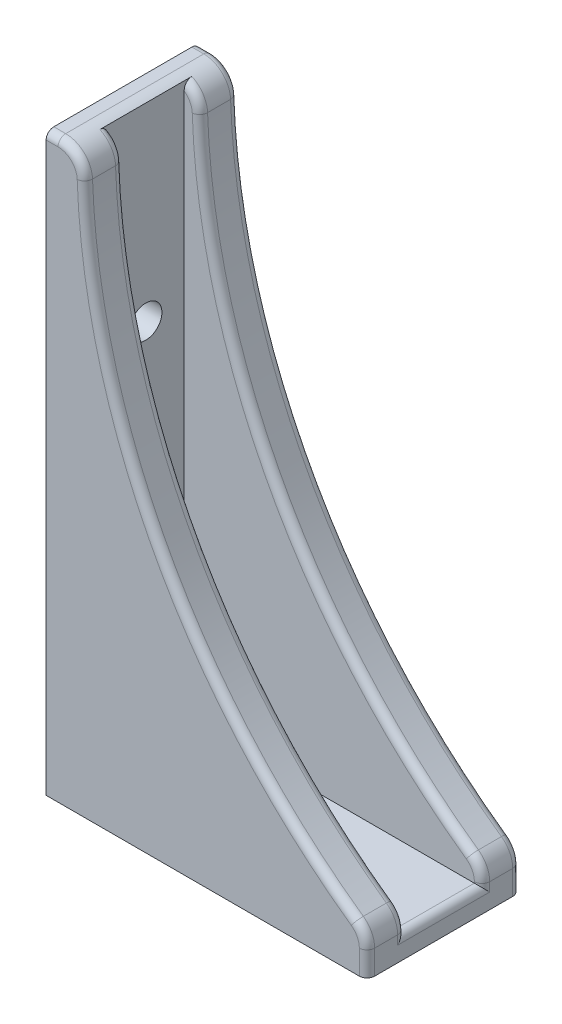
from build123d import *

# Parameters (mm, degrees)
BOSS_EXTRUDE1_DEPTH = 20
CUT_EXTRUDE1_DEPTH  = 15
BOSS_EXTRUDE2_DEPTH = 5
CUT_EXTRUDE2_REACH  = 90.178
SKETCH2_R           = 2.1
CUT_EXTRUDE3_REACH  = 90.178
SKETCH3_R           = 2.1
FILLET2_R           = 84
FILLET3_R           = 3.5
FILLET4_R           = 1


with BuildPart() as part:
    # Sketch1 → Boss-Extrude1 (new body)
    with BuildSketch(Plane.XY):
        Polygon((41.8365, 5), (5, 5), (5, 75), (0, 75), (0, 0), (41.8365, 0), align=None)
    extrude(amount=BOSS_EXTRUDE1_DEPTH)

    # Sketch1<3> → Cut-Extrude1 (cut)
    with BuildSketch(Plane.XY):
        Polygon((41.8365, 5), (5, 5), (5, 75), (3, 75), (3, 3), (41.8365, 3), align=None)
    extrude(amount=CUT_EXTRUDE1_DEPTH, mode=Mode.SUBTRACT)

    # Sketch1<4> → Boss-Extrude2 (add)
    with BuildSketch(Plane.XY):
        Polygon((41.8365, 5), (5, 5), (5, 75), (3, 75), (3, 3), (41.8365, 3), align=None)
    extrude(amount=BOSS_EXTRUDE2_DEPTH)

    # Sketch2 → Cut-Extrude2 (cut, up to next)
    with BuildSketch(Plane.XZ, mode=Mode.PRIVATE) as cut_extrude2_sk1:
        with Locations(Location((11.8365, 10, 0), (0, 0, 270))):
            Circle(SKETCH2_R)
    cut_extrude2_tool1 = extrude(cut_extrude2_sk1.sketch, amount=-CUT_EXTRUDE2_REACH, mode=Mode.PRIVATE) & part.part
    add(cut_extrude2_tool1.solids().sort_by_distance((11.8365, 0, 10))[0], mode=Mode.SUBTRACT)

    # Sketch3 → Cut-Extrude3 (cut, up to next)
    with BuildSketch(Plane.ZY, mode=Mode.PRIVATE) as cut_extrude3_sk1:
        with Locations((10, 25)):
            Circle(SKETCH3_R)
    cut_extrude3_tool1 = extrude(cut_extrude3_sk1.sketch, amount=-CUT_EXTRUDE3_REACH, mode=Mode.PRIVATE) & part.part
    # Sketch3 → Cut-Extrude3 (cut, up to next)
    with BuildSketch(Plane.ZY, mode=Mode.PRIVATE) as cut_extrude3_sk2:
        with Locations((10, 50)):
            Circle(SKETCH3_R)
    cut_extrude3_tool2 = extrude(cut_extrude3_sk2.sketch, amount=-CUT_EXTRUDE3_REACH, mode=Mode.PRIVATE) & part.part
    add(cut_extrude3_tool1.solids().sort_by_distance((0, 25, 10))[0], mode=Mode.SUBTRACT)
    add(cut_extrude3_tool2.solids().sort_by_distance((0, 50, 10))[0], mode=Mode.SUBTRACT)

    # Fillet2
    # the kernel refuses this fillet: 84 mm, written as the material it adds along each edge
    with BuildSketch(Plane(origin=(5, 5, -158.774355627), x_dir=(1, 0, 0), z_dir=(0, 0, 1))) as fillet2_piece_1_section:
        with BuildLine():
            CenterArc((84, 69.509742251), FILLET2_R, 180, 55.842464398)
            Line((0, 69.509742251), (-1.68, 69.509742251))
            Line((-1.68, 69.509742251), (-1.68, 0))
            Line((-1.68, 0), (0, -1.68))
            ThreePointArc((0, -1.68), (18.41825, -1.68), (35.89323, -1.390194845))
            Line((35.89323, -1.390194845), (36.8365, 0))
        make_face()
    fillet2_piece_1 = extrude(amount=178.774355627, mode=Mode.PRIVATE)
    fillet2_piece_1 = split(fillet2_piece_1, bisect_by=Plane(origin=(14.491057498, 22.671022952, 0), z_dir=(0, 0, 1)), keep=Keep.TOP, mode=Mode.PRIVATE)
    fillet2_piece_1 = split(fillet2_piece_1, bisect_by=Plane(origin=(14.491057498, 22.671022952, 5), z_dir=(0, 0, -1)), keep=Keep.TOP, mode=Mode.PRIVATE)
    add(fillet2_piece_1)
    with BuildSketch(Plane(origin=(5, 5, 15), x_dir=(1, 0, 0), z_dir=(0, 0, 1)), Plane(origin=(5, 5, 0), x_dir=(1, 0, 0), z_dir=(0, 0, 1))) as fillet2_piece_2:
        with BuildLine():
            CenterArc((84, 69.509742251), FILLET2_R, 180, 55.842464398)
            Line((0, 69.509742251), (-1.68, 69.509742251))
            Line((-1.68, 69.509742251), (-1.68, 0))
            Line((-1.68, 0), (0, -1.68))
            ThreePointArc((0, -1.68), (18.41825, -1.68), (35.89323, -1.390194845))
            Line((35.89323, -1.390194845), (36.8365, 0))
        make_face()
    extrude(amount=5)
    with BuildSketch(Plane(origin=(5, 5, 0), x_dir=(1, 0, 0), z_dir=(0, 0, 1))) as fillet2_piece_3_section:
        with BuildLine():
            CenterArc((84, 69.509742251), FILLET2_R, 180, 55.842464398)
            Line((0, 69.509742251), (-1.68, 69.509742251))
            Line((-1.68, 69.509742251), (-1.68, 0))
            Line((-1.68, 0), (0, -1.68))
            ThreePointArc((0, -1.68), (18.41825, -1.68), (35.89323, -1.390194845))
            Line((35.89323, -1.390194845), (36.8365, 0))
        make_face()
    fillet2_piece_3 = extrude(amount=178.774355627, mode=Mode.PRIVATE)
    fillet2_piece_3 = split(fillet2_piece_3, bisect_by=Plane(origin=(14.491057498, 22.671022952, 15), z_dir=(0, 0, 1)), keep=Keep.TOP, mode=Mode.PRIVATE)
    fillet2_piece_3 = split(fillet2_piece_3, bisect_by=Plane(origin=(14.491057498, 22.671022952, 20), z_dir=(0, 0, -1)), keep=Keep.TOP, mode=Mode.PRIVATE)
    add(fillet2_piece_3)

    # Fillet3
    # the kernel refuses this fillet: 3.5 mm, written as the material it adds along each edge
    with BuildSketch(Plane(origin=(3, 3, 5), x_dir=(1, 0, 0), z_dir=(0, 0, 1))) as fillet3_piece_1:
        with BuildLine():
            CenterArc((FILLET3_R, FILLET3_R), FILLET3_R, 180, 90)
            Line((0, FILLET3_R), (-FILLET3_R * 0.02, FILLET3_R))
            Line((-FILLET3_R * 0.02, FILLET3_R), (-FILLET3_R * 0.02, -FILLET3_R * 0.02))
            Line((-FILLET3_R * 0.02, -FILLET3_R * 0.02), (FILLET3_R, -FILLET3_R * 0.02))
            Line((FILLET3_R, -FILLET3_R * 0.02), (FILLET3_R, 0))
        make_face()
    extrude(amount=10)
    # the kernel refuses this fillet: 3.5 mm, written as the material it takes off along each edge
    with BuildSketch(Plane(origin=(5, 75, -20.689329277), x_dir=(-1, 0, 0), z_dir=(0, 0, 1))) as fillet3_2_piece_1:
        with BuildLine():
            CenterArc((3.448221546, 3.5), FILLET3_R, 181.971194875, 88.028805125)
            Line((-0.049707316, 3.37961031), (-0.399500202, 3.367571341))
            ThreePointArc((-0.399500202, 3.367571341), (-0.35, 0.490257749), (-0.35, 0))
            Line((-0.35, 0), (0, -0.35))
            Line((0, -0.35), (3.448221546, -0.35))
            Line((3.448221546, -0.35), (3.448221546, 0))
        make_face()
    extrude(amount=46.378658554, mode=Mode.SUBTRACT)
    with BuildSketch(Plane(origin=(41.8365, 5, -10.984244879), x_dir=(0, -1, 0), z_dir=(0, 0, 1))) as fillet3_2_piece_2:
        with BuildLine():
            CenterArc((1.83070748, -3.5), FILLET3_R, 90, 54.618958209)
            Line((-1.022910509, -1.47346), (-1.079982869, -1.4329292))
            ThreePointArc((-1.079982869, -1.4329292), (-0.565023995, -0.699541323), (-0.057924785, 0.039302917))
            Line((-0.057924785, 0.039302917), (0, 0.07))
            Line((0, 0.07), (1.83070748, 0.07))
            Line((1.83070748, 0.07), (1.83070748, 0))
        make_face()
    extrude(amount=26.968489758, mode=Mode.SUBTRACT)
    with BuildSketch(Plane(origin=(41.8365, 5, 4.015755121), x_dir=(-0.8214550012543749, 0.5702733387720094, 0), z_dir=(0, 0, 1))) as fillet3_2_piece_3:
        with BuildLine():
            CenterArc((1.831088838, 3.499800501), FILLET3_R, 214.769288697, 54.618958209)
            Line((-1.044003667, 1.503843815), (-1.101505517, 1.463924681))
            Line((-1.101505517, 1.463924681), (-0.05750185, -0.039919134))
            Line((-0.05750185, -0.039919134), (0.000747383, -0.06999601))
            ThreePointArc((0.000747383, -0.06999601), (0.896859839, -0.065212021), (1.792972294, -0.06999601))
            Line((1.792972294, -0.06999601), (1.793719678, 0))
        make_face()
    extrude(amount=26.968489758, mode=Mode.SUBTRACT)

    # Fillet4
    fillet4_edges = [part.edges().sort_by_distance(p)[0] for p in [
        (0.775889227, 75, 20),
        (41.446394693, 4.775080489, 15),
        (4.461432686, 73.445228071, 15),
        (15.036480531, 34.69268827, 20),
        (41.446394693, 4.775080489, 20),
        (3.983715551, 74.017078059, 20),
        (0.775889227, 75, 0),
        (41.8365, 1.58464626, 20),
        (41.8365, 3.08464626, 15),
        (41.8365, 3, 10),
        (41.8365, 3.08464626, 5),
        (41.8365, 1.58464626, 0),
        (15.036480531, 34.69268827, 0),
        (41.446394693, 4.775080489, 0),
        (3.983715551, 74.017078059, 0),
        (15.036480531, 34.69268827, 5),
        (41.446394693, 4.775080489, 5),
        (4.461432686, 73.445228071, 5),
        (15.036480531, 34.69268827, 15),
    ]]
    fillet(fillet4_edges, radius=FILLET4_R)


solid = part.part
